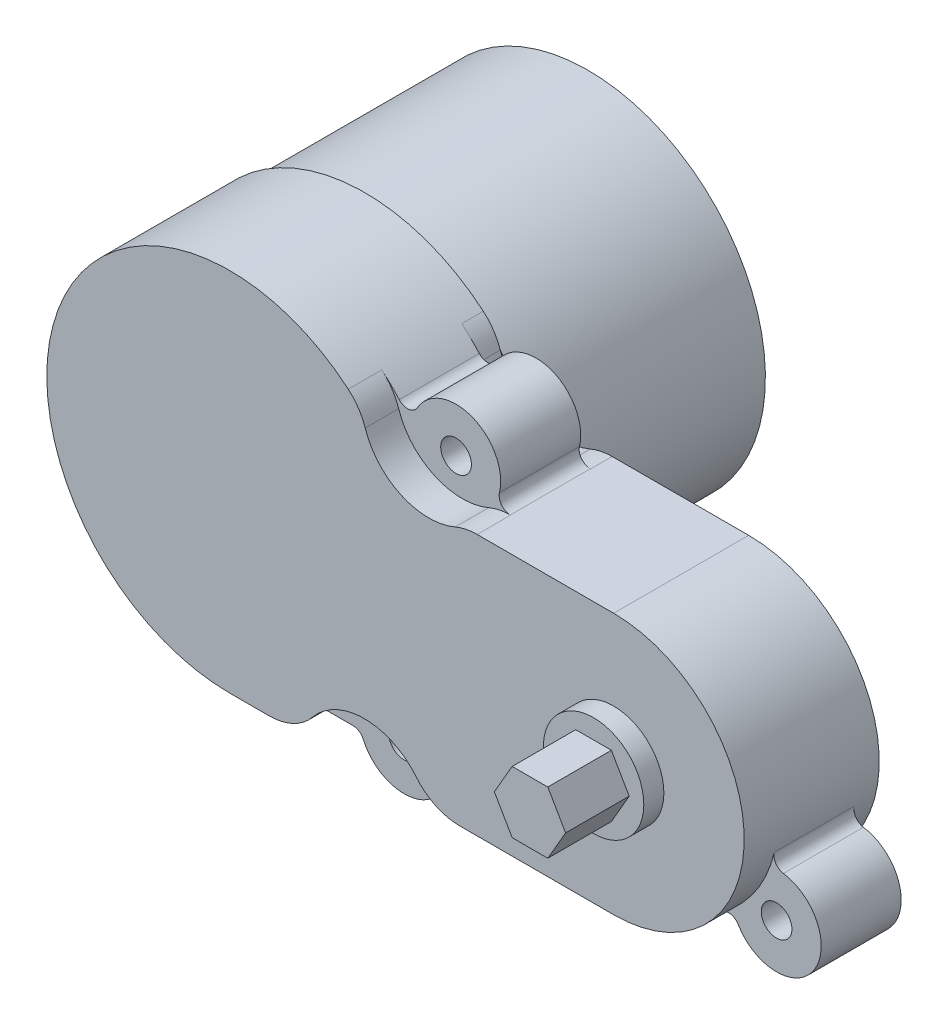
from build123d import *

# Parameters (mm, degrees)
BOSS_EXTRUDE1_DEPTH = 12.1
SKETCH2_R           = 4
BOSS_EXTRUDE2_DEPTH = 7.17
SKETCH3_R           = 15.9
BOSS_EXTRUDE3_DEPTH = 20
SKETCH4_R           = 3.75
BOSS_EXTRUDE4_DEPTH = 3.2
SKETCH5_R           = 4.5
BOSS_EXTRUDE5_DEPTH = 1.8
BOSS_EXTRUDE6_DEPTH = 5.7
SKETCH8_R           = 6
CUT_EXTRUDE2_DEPTH  = 3
SKETCH7_R           = 1.375
CUT_EXTRUDE1_DEPTH  = 63.607108223
CUT_EXTRUDE3_START  = -1.93
SKETCH9_R           = 6
CUT_EXTRUDE3_DEPTH  = 1.93
FILLET1_R           = 1
FILLET2_R           = 5


with BuildPart() as part:
    # Sketch1 → Boss-Extrude1 (new body)
    with BuildSketch(Plane.XY):
        with BuildLine():
            Line((0, -16.4), (34.4, -16.4))
            ThreePointArc((34.4, -16.4), (46.1, -4.7), (34.4, 7))
            Line((34.4, 7), (14.831048513, 7))
            ThreePointArc((14.831048513, 7), (-13.852075657, 8.779521627), (0, -16.4))
        make_face()
    extrude(amount=BOSS_EXTRUDE1_DEPTH)

    # Sketch2 → Boss-Extrude2 (add)
    with BuildSketch(Plane.XY.offset(9.1)):
        with Locations((17.276313416, 9.163011328)):
            Circle(SKETCH2_R)
        with Locations((46, -12.538367177)):
            Circle(SKETCH2_R)
        with Locations((12.6224468, -15.4)):
            Circle(SKETCH2_R)
    extrude(amount=-BOSS_EXTRUDE2_DEPTH)

    # Sketch3 → Boss-Extrude3 (add)
    with BuildSketch(Plane(origin=(0, 0, 0), x_dir=(-1, 0, 0), z_dir=(0, 0, -1))):
        Circle(SKETCH3_R)
    extrude(amount=BOSS_EXTRUDE3_DEPTH)

    # Sketch4 → Boss-Extrude4 (add)
    with BuildSketch(Plane(origin=(0, 0, -20), x_dir=(-1, 0, 0), z_dir=(0, 0, -1))):
        Circle(SKETCH4_R)
    extrude(amount=BOSS_EXTRUDE4_DEPTH)

    # Sketch5 → Boss-Extrude5 (add)
    with BuildSketch(Plane.XY.offset(12.1)):
        with Locations((34.4, -4.7)):
            Circle(SKETCH5_R)
    extrude(amount=BOSS_EXTRUDE5_DEPTH)

    # Sketch6 → Boss-Extrude6 (add)
    with BuildSketch(Plane.XY.offset(13.9)):
        Polygon((35.996373494, -7.465), (37.592746989, -4.7), (35.996373494, -1.935), (32.803626506, -1.935), (31.207253011, -4.7), (32.803626506, -7.465), align=None)
    extrude(amount=BOSS_EXTRUDE6_DEPTH)

    # Sketch8 → Cut-Extrude2 (cut)
    with BuildSketch(Plane.XY.offset(12.1)):
        with Locations((17.83477741, 12.110572688)):
            Circle(SKETCH8_R)
        with Locations((12.063982807, -18.347561359)):
            Circle(SKETCH8_R)
    extrude(amount=-CUT_EXTRUDE2_DEPTH, mode=Mode.SUBTRACT)

    # Sketch7 → Cut-Extrude1 (cut, through all)
    with BuildSketch(Plane.XY.offset(9.1)):
        with Locations((17.276313416, 9.163011328)):
            Circle(SKETCH7_R)
        with Locations((46, -12.538367177)):
            Circle(SKETCH7_R)
        with Locations((12.6224468, -15.4)):
            Circle(SKETCH7_R)
    extrude(amount=-CUT_EXTRUDE1_DEPTH, mode=Mode.SUBTRACT)

    # Sketch9 → Cut-Extrude3 (cut)
    with BuildSketch(Plane(origin=(0, 0, 0), x_dir=(-1, 0, 0), z_dir=(0, 0, -1)).offset(CUT_EXTRUDE3_START)):
        with Locations((-12.063982807, -18.347561359)):
            Circle(SKETCH9_R)
        with Locations((-17.83477741, 12.110572688)):
            Circle(SKETCH9_R)
    extrude(amount=CUT_EXTRUDE3_DEPTH, mode=Mode.SUBTRACT)

    # Fillet1
    # the kernel refuses this fillet: 1 mm, written as the material it adds along each edge
    with BuildSketch(Plane(origin=(8.749463454, -16.4, 1.93), x_dir=(-1, 0, 0), z_dir=(0, 0, 1))) as fillet1_piece_1:
        with BuildLine():
            CenterArc((0.709592349, 1), FILLET1_R, 203.578178478, 66.421821522)
            ThreePointArc((-0.20692279, 0.6), (-0.091542385, 0.304110525), (0, 0))
            Line((0, 0), (0.709592349, 0))
        make_face()
    extrude(amount=7.17)
    with BuildSketch(Plane(origin=(16.495430147, -16.4, 1.93), x_dir=(1, 0, 0), z_dir=(0, 0, 1))) as fillet1_piece_2:
        with BuildLine():
            CenterArc((0.709592349, -1), FILLET1_R, 90, 66.421821522)
            ThreePointArc((-0.20692279, -0.6), (-0.091542385, -0.304110525), (0, 0))
            Line((0, 0), (0.709592349, 0))
        make_face()
    extrude(amount=7.17)
    with BuildSketch(Plane(origin=(42.116078953, -13.495005719, 9.1), x_dir=(-0.786111356647784, -0.6180848929955987, 0), z_dir=(0, 0, -1))) as fillet1_piece_3:
        with BuildLine():
            CenterArc((1.313089389, -0.998550915), FILLET1_R, 93.084870556, 94.384925022)
            ThreePointArc((0.321575856, -1.128554433), (0.202398335, -0.552420542), (0, 0))
            ThreePointArc((0, 0), (0.629637125, -0.016954289), (1.25927425, 0))
        make_face()
    extrude(amount=7.17)
    with BuildSketch(Plane(origin=(45.438635333, -8.577954356, 9.1), x_dir=(0.2801956563205793, 0.959942911937517, 0), z_dir=(0, 0, -1))) as fillet1_piece_4:
        with BuildLine():
            CenterArc((1.313089389, 0.998550915), FILLET1_R, 172.530204422, 94.384925022)
            ThreePointArc((0.321575856, 1.128554433), (0.202398335, 0.552420542), (0, 0))
            ThreePointArc((0, 0), (0.629637125, 0.016954289), (1.25927425, 0))
        make_face()
    extrude(amount=7.17)
    with BuildSketch(Plane(origin=(13.299776183, 9.595621579, 9.1), x_dir=(-0.6279509963726487, 0.7782528805951172, 0), z_dir=(0, 0, -1))) as fillet1_piece_5:
        with BuildLine():
            CenterArc((1.821464626, 0.998546906), FILLET1_R, 158.597997632, 108.312865848)
            ThreePointArc((0.890421562, 1.363456228), (0.515330012, 0.635935903), (0, 0))
            ThreePointArc((0, 0), (0.88378757, 0.023830743), (1.76757514, 0))
        make_face()
    extrude(amount=7.17)
    with BuildSketch(Plane(origin=(20.641039556, 7, -1.81533395), x_dir=(1, 0, 0), z_dir=(0, 0, 1))) as fillet1_piece_6_section:
        with BuildLine():
            CenterArc((1.49813358, 1), FILLET1_R, 166.549673426, 103.450326574)
            ThreePointArc((0.525561636, 1.232602266), (0.314762115, 0.59413715), (0, 0))
            Line((0, 0), (1.49813358, 0))
        make_face()
    fillet1_piece_6 = extrude(amount=10.91533395, mode=Mode.PRIVATE)
    fillet1_piece_6 = fillet1_piece_6 - Plane(origin=(17.83477741, 12.110572688, 0.965), x_dir=(-1, 0, 0), z_dir=(0, 0, 1)) * Cylinder(6, 28, mode=Mode.PRIVATE)
    fillet1_piece_6 = split(fillet1_piece_6, bisect_by=Plane(origin=(21.45614867, 7.07760615, 0), z_dir=(0, 0, 1)), keep=Keep.TOP, mode=Mode.PRIVATE)
    fillet1_piece_6 = split(fillet1_piece_6, bisect_by=Plane(origin=(21.45614867, 7.07760615, 1.93), z_dir=(0, 0, -1)), keep=Keep.TOP, mode=Mode.PRIVATE)
    add(fillet1_piece_6)
    with BuildSketch(Plane(origin=(20.641039556, 7, 1.93), x_dir=(1, 0, 0), z_dir=(0, 0, 1))) as fillet1_piece_7_section:
        with BuildLine():
            CenterArc((1.49813358, 1), FILLET1_R, 166.549673426, 103.450326574)
            ThreePointArc((0.525561636, 1.232602266), (0.314762115, 0.59413715), (0, 0))
            Line((0, 0), (1.49813358, 0))
        make_face()
    fillet1_piece_7 = extrude(amount=7.17, mode=Mode.PRIVATE)
    fillet1_piece_7 = fillet1_piece_7 - Plane(origin=(17.83477741, 12.110572688, 5.515), x_dir=(-1, 0, 0), z_dir=(0, 0, 1)) * Cylinder(6, 21, mode=Mode.PRIVATE)
    add(fillet1_piece_7)
    with BuildSketch(Plane(origin=(20.641039556, 7, 1.93), x_dir=(1, 0, 0), z_dir=(0, 0, 1))) as fillet1_piece_8_section:
        with BuildLine():
            CenterArc((1.49813358, 1), FILLET1_R, 166.549673426, 103.450326574)
            ThreePointArc((0.525561636, 1.232602266), (0.314762115, 0.59413715), (0, 0))
            Line((0, 0), (1.49813358, 0))
        make_face()
    fillet1_piece_8 = extrude(amount=7.17, mode=Mode.PRIVATE)
    fillet1_piece_8 = fillet1_piece_8 & Plane(origin=(17.83477741, 12.110572688, 5.515), x_dir=(-1, 0, 0), z_dir=(0, 0, 1)) * Cylinder(6, 21, mode=Mode.PRIVATE)
    add(fillet1_piece_8)
    with BuildSketch(Plane(origin=(20.641039556, 7, 1.93), x_dir=(1, 0, 0), z_dir=(0, 0, 1))) as fillet1_piece_9_section:
        with BuildLine():
            CenterArc((1.49813358, 1), FILLET1_R, 166.549673426, 103.450326574)
            ThreePointArc((0.525561636, 1.232602266), (0.314762115, 0.59413715), (0, 0))
            Line((0, 0), (1.49813358, 0))
        make_face()
    fillet1_piece_9 = extrude(amount=10.91533395, mode=Mode.PRIVATE)
    fillet1_piece_9 = fillet1_piece_9 - Plane(origin=(17.83477741, 12.110572688, 10.6), x_dir=(-1, 0, 0), z_dir=(0, 0, 1)) * Cylinder(6, 28, mode=Mode.PRIVATE)
    fillet1_piece_9 = split(fillet1_piece_9, bisect_by=Plane(origin=(21.45614867, 7.07760615, 9.1), z_dir=(0, 0, 1)), keep=Keep.TOP, mode=Mode.PRIVATE)
    fillet1_piece_9 = split(fillet1_piece_9, bisect_by=Plane(origin=(21.45614867, 7.07760615, 12.1), z_dir=(0, 0, -1)), keep=Keep.TOP, mode=Mode.PRIVATE)
    add(fillet1_piece_9)

    # Fillet2
    # the kernel refuses this fillet: 5 mm, written as the material it takes off along each edge
    with BuildSketch(Plane(origin=(17.739104369, -16.4, -7.132871381), x_dir=(-0.4856410354617555, 0.8741583292948903, 0), z_dir=(0, 0, 1))) as fillet2_piece_1:
        with BuildLine():
            CenterArc((2.985185629, -4.922308749), FILLET2_R, 100.113527083, 50.831993071)
            Line((-1.385606017, -2.494103572), (0, 0))
            ThreePointArc((0, 0), (1.053594928, -0.093229501), (2.107189856, 0))
        make_face()
    extrude(amount=9.062871381, mode=Mode.SUBTRACT)
    with BuildSketch(Plane(origin=(6.388861244, -16.4, -7.132871381), x_dir=(-1, 0, 0), z_dir=(0, 0, 1))) as fillet2_piece_2:
        with BuildLine():
            CenterArc((2.853148552, -5), FILLET2_R, 90, 50.831993071)
            ThreePointArc((-1.023337864, -1.842017564), (-0.430171587, -0.966284853), (0, 0))
            Line((0, 0), (2.853148552, 0))
        make_face()
    extrude(amount=9.062871381, mode=Mode.SUBTRACT)
    with BuildSketch(Plane(origin=(17.739104369, -16.4, 9.1), x_dir=(-0.4856410354617568, 0.8741583292948896, 0), z_dir=(0, 0, 1))) as fillet2_piece_3:
        with BuildLine():
            CenterArc((2.985185629, -4.922308749), FILLET2_R, 100.113527083, 50.831993071)
            Line((-1.385606017, -2.494103572), (0, 0))
            ThreePointArc((0, 0), (1.053594928, -0.093229501), (2.107189856, 0))
        make_face()
    extrude(amount=10.132871381, mode=Mode.SUBTRACT)
    with BuildSketch(Plane(origin=(6.388861244, -16.4, 9.1), x_dir=(-1, 0, 0), z_dir=(0, 0, 1))) as fillet2_piece_4:
        with BuildLine():
            CenterArc((2.853148552, -5), FILLET2_R, 90, 50.831993071)
            ThreePointArc((-1.023337864, -1.842017564), (-0.430171587, -0.966284853), (0, 0))
            Line((0, 0), (2.853148552, 0))
        make_face()
    extrude(amount=10.132871381, mode=Mode.SUBTRACT)
    with BuildSketch(Plane(origin=(11.890467167, 11.294989621, 1.93), x_dir=(-0.7264583233980587, 0.6872105240504408, 0), z_dir=(0, 0, -1))) as fillet2_piece_5:
        with BuildLine():
            CenterArc((1.484745631, -4.99286384), FILLET2_R, 86.938483712, 31.524868326)
            ThreePointArc((-0.898237104, -0.597253156), (-0.435669612, -0.318853072), (0, 0))
            ThreePointArc((0, 0), (0.875893106, 0.023406604), (1.751786212, 0))
        make_face()
    extrude(amount=1.93, mode=Mode.SUBTRACT)
    with BuildSketch(Plane(origin=(21.423177854, 7.301894881, -3.534616353), x_dir=(0.9267551866460263, -0.37566584090743305, 0), z_dir=(0, 0, 1))) as fillet2_piece_6:
        with BuildLine():
            CenterArc((2.681955321, -4.633775933), FILLET2_R, 112.065471844, 23.198889906)
            Line((-0.869853786, -1.114592496), (-1.225034697, -0.762674153))
            ThreePointArc((-1.225034697, -0.762674153), (-0.796151939, -0.275387861), (-0.427668726, 0.259035636))
            Line((-0.427668726, 0.259035636), (0.200649047, 0.457973755))
            ThreePointArc((0.200649047, 0.457973755), (0.589131014, 0.452569916), (0.615793196, 0.463377593))
            Line((0.615793196, 0.463377593), (0.803626117, 0))
        make_face()
    extrude(amount=5.464616353, mode=Mode.SUBTRACT)
    with BuildSketch(Plane(origin=(21.423177854, 7.301894881, 15.634616353), x_dir=(0.9267551866460257, -0.3756658409074346, 0), z_dir=(0, 0, -1))) as fillet2_piece_7:
        with BuildLine():
            CenterArc((2.681955321, 4.633775933), FILLET2_R, 224.73563825, 23.198889906)
            Line((-0.869853786, 1.114592496), (-1.225034697, 0.762674153))
            ThreePointArc((-1.225034697, 0.762674153), (-0.796151939, 0.275387861), (-0.427668726, -0.259035636))
            Line((-0.427668726, -0.259035636), (0.200649047, -0.457973755))
            ThreePointArc((0.200649047, -0.457973755), (0.589131014, -0.452569916), (0.615793196, -0.463377593))
            Line((0.615793196, -0.463377593), (0.803626117, 0))
        make_face()
    extrude(amount=6.534616353, mode=Mode.SUBTRACT)
    with BuildSketch(Plane(origin=(11.890467167, 11.294989621, 16.479465531), x_dir=(-0.7264583233980683, 0.6872105240504307, 0), z_dir=(0, 0, -1))) as fillet2_piece_8:
        with BuildLine():
            CenterArc((1.484745631, -4.99286384), FILLET2_R, 86.938483712, 31.524868326)
            ThreePointArc((-0.898237104, -0.597253156), (-0.435669612, -0.318853072), (0, 0))
            ThreePointArc((0, 0), (0.875893106, 0.023406604), (1.751786212, 0))
        make_face()
    extrude(amount=7.379465531, mode=Mode.SUBTRACT)


solid = part.part
